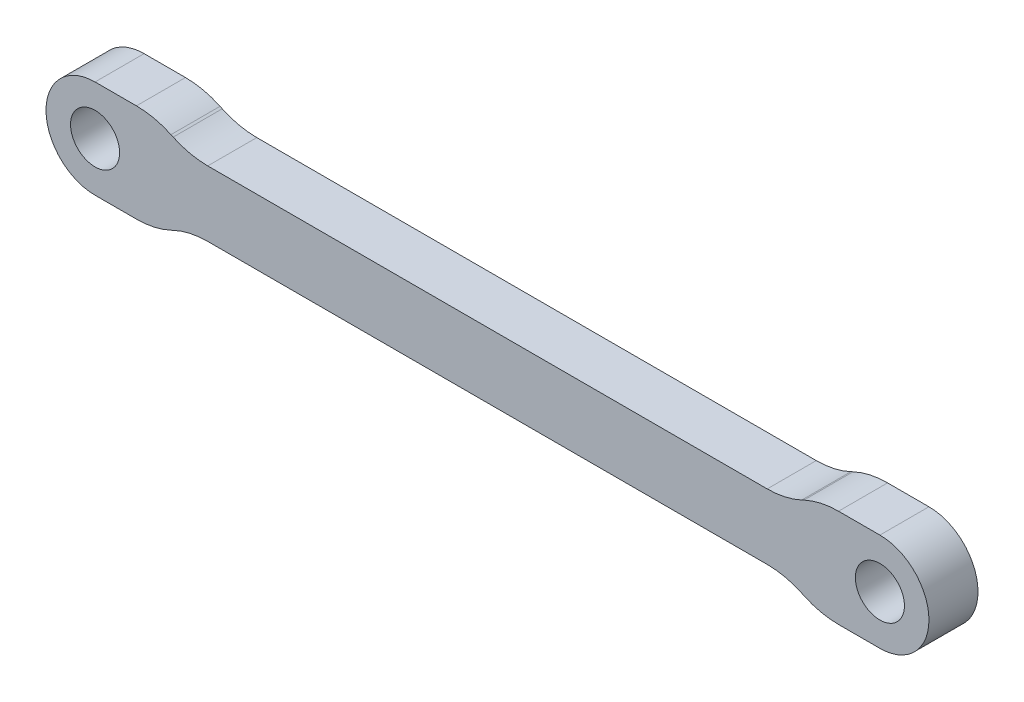
from build123d import *

# Parameters (mm, degrees)
SKETCH1_R           = 3
BOSS_EXTRUDE2_DEPTH = 6
SKETCH2_W           = 60
SKETCH2_H           = 4
CUT_EXTRUDE2_DEPTH  = 103.352332655
CHAMFER2_SIZE       = 10.722534603
CHAMFER2_SIZE_2     = 5
FILLET2_R           = 10


with BuildPart() as part:
    # Sketch1 → Boss-Extrude2 (new body)
    with BuildSketch(Plane.XY):
        with BuildLine():
            Line((0, 6), (96, 6))
            ThreePointArc((96, 6), (102, 0), (96, -6))
            Line((96, -6), (0, -6))
            ThreePointArc((0, -6), (-6, 0), (0, 6))
        make_face()
        Circle(SKETCH1_R, mode=Mode.SUBTRACT)
        with Locations((96, 0)):
            Circle(SKETCH1_R, mode=Mode.SUBTRACT)
    extrude(amount=BOSS_EXTRUDE2_DEPTH)

    # Sketch2 → Cut-Extrude2 (cut, through all)
    with BuildSketch(Plane.XY.offset(6)):
        with Locations((48, -6)):
            Rectangle(SKETCH2_W, SKETCH2_H)
        with Locations((48, 6)):
            Rectangle(SKETCH2_W, SKETCH2_H)
    extrude(amount=-CUT_EXTRUDE2_DEPTH, mode=Mode.SUBTRACT)

    # Chamfer2
    # the kernel refuses this chamfer: 10.722534603, 5 mm, written as the material it takes off along each edge
    with BuildSketch(Plane(origin=(78, 6, -27.781824147), x_dir=(0.9998669641130703, 0.01631116413111023, 0), z_dir=(0, 0, 1))) as chamfer2_piece_1_section:
        Polygon((CHAMFER2_SIZE * 0.999866964071, -CHAMFER2_SIZE * 0.0163111641304), (-CHAMFER2_SIZE_2 * 0.0163111641311, -CHAMFER2_SIZE_2 * 0.999866964113), (0, 0), align=None)
    chamfer2_piece_1 = extrude(amount=61.563648293, mode=Mode.PRIVATE)
    chamfer2_piece_1 = split(chamfer2_piece_1, bisect_by=Plane(origin=(82.533411446, 4, 3), z_dir=(0, 1, 0)), keep=Keep.TOP, mode=Mode.PRIVATE)
    add(chamfer2_piece_1, mode=Mode.SUBTRACT)
    with BuildSketch(Plane(origin=(78, -6, -27.781824147), x_dir=(-0.07481330637060442, 0.997197557753677, 0), z_dir=(0, 0, 1))) as chamfer2_piece_2_section:
        Polygon((CHAMFER2_SIZE_2 * 0.997197557754, -CHAMFER2_SIZE_2 * 0.0748133063706), (-CHAMFER2_SIZE * 0.0748133063675, -CHAMFER2_SIZE * 0.997197557712), (0, 0), align=None)
    chamfer2_piece_2 = extrude(amount=61.563648293, mode=Mode.PRIVATE)
    chamfer2_piece_2 = split(chamfer2_piece_2, bisect_by=Plane(origin=(82.533411446, -4, 3), z_dir=(0, -1, 0)), keep=Keep.TOP, mode=Mode.PRIVATE)
    add(chamfer2_piece_2, mode=Mode.SUBTRACT)
    with BuildSketch(Plane(origin=(18, -6, 33.781824147), x_dir=(-0.9998669641130703, -0.0163111641311102, 0), z_dir=(0, 0, -1))) as chamfer2_piece_3_section:
        Polygon((CHAMFER2_SIZE * 0.999866964071, CHAMFER2_SIZE * 0.0163111641304), (-CHAMFER2_SIZE_2 * 0.0163111641311, CHAMFER2_SIZE_2 * 0.999866964113), (0, 0), align=None)
    chamfer2_piece_3 = extrude(amount=61.563648293, mode=Mode.PRIVATE)
    chamfer2_piece_3 = split(chamfer2_piece_3, bisect_by=Plane(origin=(13.466588554, -4, 3), z_dir=(0, -1, 0)), keep=Keep.TOP, mode=Mode.PRIVATE)
    add(chamfer2_piece_3, mode=Mode.SUBTRACT)
    with BuildSketch(Plane(origin=(18, 6, 33.781824147), x_dir=(-0.9998669641130703, 0.016311164131110195, 0), z_dir=(0, 0, -1))) as chamfer2_piece_4_section:
        Polygon((CHAMFER2_SIZE * 0.999866964071, -CHAMFER2_SIZE * 0.0163111641304), (-CHAMFER2_SIZE_2 * 0.0163111641311, -CHAMFER2_SIZE_2 * 0.999866964113), (0, 0), align=None)
    chamfer2_piece_4 = extrude(amount=61.563648293, mode=Mode.PRIVATE)
    chamfer2_piece_4 = split(chamfer2_piece_4, bisect_by=Plane(origin=(13.466588554, 4, 3), z_dir=(0, 1, 0)), keep=Keep.TOP, mode=Mode.PRIVATE)
    add(chamfer2_piece_4, mode=Mode.SUBTRACT)

    # Fillet2
    fillet2_edges = [part.edges().sort_by_distance(p)[0] for p in [
        (88.722534603, 6, 3),
        (88.722534603, -6, 3),
        (7.277465397, -6, 3),
        (7.277465397, 6, 3),
        (84.433520762, 4, 3),
        (84.433520762, -4, 3),
        (11.566479238, -4, 3),
        (11.566479238, 4, 3),
    ]]
    fillet(fillet2_edges, radius=FILLET2_R)


solid = part.part
